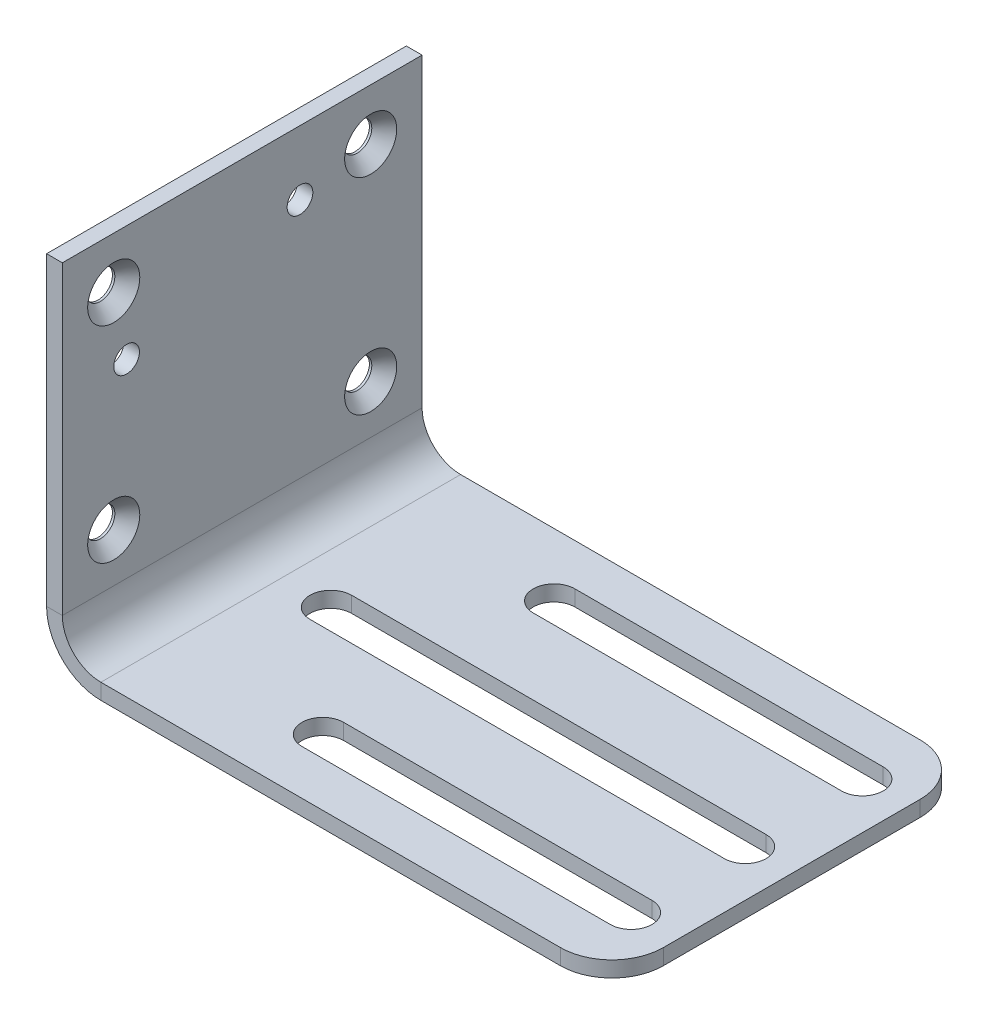
from build123d import *

# Parameters (mm, degrees)
BASE_FLANGE1_DEPTH          = 44.45
LONG_SLOT_DEPTH             = 170.46496681
SHORT_SLOT_DEPTH            = 170.46496681
LPATTERN1_COUNT             = 2
LPATTERN1_PITCH             = 57.15
LPATTERN2_COUNT             = 2
LPATTERN2_PITCH             = 63.5
LPATTERN2_COUNT_DIR2        = 2
LPATTERN2_PITCH_DIR2        = 50.8
F_1_4_0_25_DIAMETER_HOLE1_D = 6.35
FILLET1_R                   = 12.7


# Sheet-metal steps are written as plain solids
with BuildPart() as part:
    # Sketch1 → Base-Flange1 (new, symmetric)
    with BuildSketch(Plane.XY):
        with BuildLine():
            Line((139.7, 0), (13.41628, 0))
            ThreePointArc((13.41628, 0), (3.929537434, 3.929537434), (0, 13.41628))
            Line((0, 13.41628), (0, 88.9))
            Line((0, 88.9), (3.89128, 88.9))
            Line((3.89128, 88.9), (3.89128, 13.41628))
            ThreePointArc((3.89128, 13.41628), (6.681087909, 6.681087909), (13.41628, 3.89128))
            Line((13.41628, 3.89128), (139.7, 3.89128))
            Line((139.7, 3.89128), (139.7, 0))
        make_face()
    extrude(amount=BASE_FLANGE1_DEPTH, both=True)

    # Sketch4 → LONG-SLOT (cut, through all)
    with BuildSketch(Plane(origin=(0, 3.89128, 0), x_dir=(1, 0, 0), z_dir=(0, 1, 0))):
        with BuildLine():
            Line((25.781, 5.1562), (128.1938, 5.1562))
            ThreePointArc((128.1938, 5.1562), (133.35, 0), (128.1938, -5.1562))
            Line((128.1938, -5.1562), (25.781, -5.1562))
            ThreePointArc((25.781, -5.1562), (20.6248, 0), (25.781, 5.1562))
        make_face()
    extrude(amount=-LONG_SLOT_DEPTH, mode=Mode.SUBTRACT)

    # Sketch5 → SHORT-SLOT (cut, through all)
    with BuildSketch(Plane(origin=(0, 3.89128, 0), x_dir=(1, 0, 0), z_dir=(0, 1, 0))):
        with BuildLine():
            Line((51.9938, -23.0378), (128.1938, -23.0378))
            ThreePointArc((128.1938, -23.0378), (133.35, -28.194), (128.1938, -33.3502))
            Line((128.1938, -33.3502), (51.9938, -33.3502))
            ThreePointArc((51.9938, -33.3502), (46.8376, -28.194), (51.9938, -23.0378))
        make_face()
    short_slot = extrude(amount=-SHORT_SLOT_DEPTH, mode=Mode.SUBTRACT)

    # LPattern1: SHORT-SLOT ×2
    with Locations(*[(0, 0, -i * LPATTERN1_PITCH) for i in range(1, LPATTERN1_COUNT)]):
        add(short_slot, mode=Mode.SUBTRACT)

    # Sketch6 → CSK for 1/4 Flat Head Machine Screw1 (revolve, cut)
    with BuildSketch(Plane(origin=(3.89128, 76.2, 31.75), x_dir=(0, 0, -1), z_dir=(0, 1, 0))):
        Polygon((0, 0), (0, 3.89128), (3.57124, 3.89128), (3.57124, 3.298865467), (6.4389, 0), align=None)
    csk_for_1_4_flat_head_machine_screw1 = revolve(axis=Axis((10.24128, 76.2, 31.75), (-1, 0, 0)), mode=Mode.SUBTRACT)

    # LPattern2: CSK for 1_4 Flat Head Machine Screw1 2 × 2
    with Locations(*[(0, -j * LPATTERN2_PITCH_DIR2, -i * LPATTERN2_PITCH) for i in range(LPATTERN2_COUNT) for j in range(LPATTERN2_COUNT_DIR2) if (i, j) != (0, 0)]):
        add(csk_for_1_4_flat_head_machine_screw1, mode=Mode.SUBTRACT)

    # 1/4 (0.25) Diameter Hole1 (through all)
    with Locations(Plane(origin=(3.89128, 0, 0), x_dir=(0, 0, -1), z_dir=(1, 0, 0))):
        with Locations((-28.575, 60.325), (14.2748, 73.025)):
            Hole(F_1_4_0_25_DIAMETER_HOLE1_D / 2)

    # Fillet1
    fillet1_edges = [part.edges().sort_by_distance(p)[0] for p in [
        (139.7, 1.94564, 44.45),
        (139.7, 1.94564, -44.45),
    ]]
    fillet(fillet1_edges, radius=FILLET1_R)


solid = part.part
